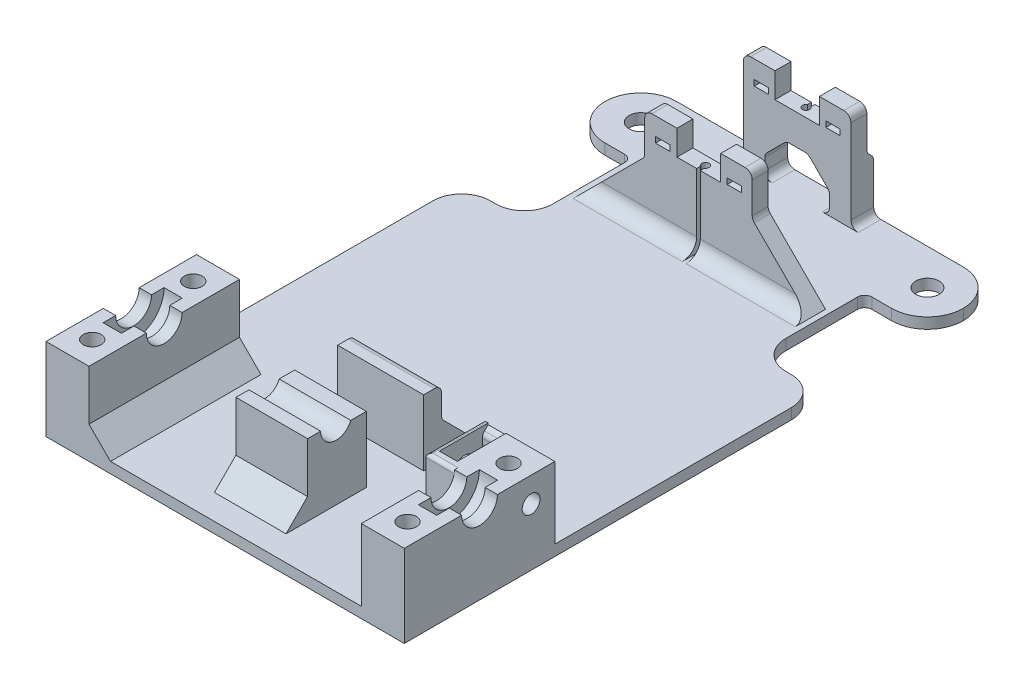
from build123d import *

# Parameters (mm, degrees)
BOSS_EXTRUDE1_DEPTH = 3
SKETCH2_W           = 12
SKETCH2_H           = 42
BOSS_EXTRUDE2_DEPTH = 20
SKETCH3_R           = 8.5
CUT_EXTRUDE1_DEPTH  = 2.55
CUT_EXTRUDE2_REACH  = 180.452
SKETCH4_R           = 5
BOSS_EXTRUDE3_DEPTH = 10
CHAMFER1_SIZE       = 6
CUT_EXTRUDE3_REACH  = 180.452
SKETCH7_R           = 2.5
CUT_EXTRUDE4_REACH  = 180.09
SKETCH8_W           = 8
SKETCH8_H           = 1.6
SKETCH9_W           = 8
SKETCH9_H           = 16
BOSS_EXTRUDE4_DEPTH = 20
CUT_EXTRUDE6_START  = -1.4
SKETCH11_R          = 5.55
CUT_EXTRUDE6_DEPTH  = 5
CUT_EXTRUDE7_START  = -1.4
CUT_EXTRUDE7_DEPTH  = 5
CHAMFER3_SIZE       = 2
CUT_EXTRUDE8_START  = -20
SKETCH13_R          = 2.5
CUT_EXTRUDE8_DEPTH  = 20
FILLET3_R           = 2
FILLET5_R           = 1
SKETCH14_W          = 24
SKETCH14_H          = 5
BOSS_EXTRUDE5_DEPTH = 18.4
CHAMFER4_SIZE       = 10
SKETCH15_W          = 100
SKETCH15_H          = 20
SKETCH15_R          = 3.25
BOSS_EXTRUDE6_DEPTH = 3
BOSS_EXTRUDE7_DEPTH = 20.5
SKETCH17_W          = 18
SKETCH17_H          = 12
CUT_EXTRUDE9_DEPTH  = 6.35
FILLET7_R           = 10
CHAMFER5_START      = -136.55
CHAMFER5_DEPTH      = 4.45
CHAMFER5_START_2    = 35
CHAMFER5_2_DEPTH    = 6
CHAMFER5_START_3    = 59
CHAMFER5_3_DEPTH    = 6
CHAMFER5_START_4    = 41
CHAMFER5_4_DEPTH    = 8.5
CHAMFER5_START_5    = 50.5
CHAMFER5_5_DEPTH    = 8.5
CHAMFER6_SIZE       = 6
FILLET6_R           = 2
SKETCH18_W          = 8.8
SKETCH18_H          = 4.45
SKETCH18_W_2        = 9
BOSS_EXTRUDE8_DEPTH = 7
FILLET9_R           = 4
FILLET8_R           = 2
CUT_EXTRUDE10_REACH = 196.574
SKETCH19_W          = 4
SKETCH19_H          = 1.6


with BuildPart() as part:
    # Sketch1 → Boss-Extrude1 (new body)
    with BuildSketch(Plane(origin=(0, 0, 0), x_dir=(1, 0, 0), z_dir=(0, 1, 0))):
        with BuildLine():
            Line((8, 116), (9.5, 116))
            ThreePointArc((9.5, 116), (15.156854249, 118.343145751), (17.5, 124))
            Line((17.5, 124), (17.5, 146))
            Line((17.5, 146), (82.5, 146))
            Line((82.5, 146), (82.5, 124))
            ThreePointArc((82.5, 124), (84.843145751, 118.343145751), (90.5, 116))
            Line((90.5, 116), (92, 116))
            ThreePointArc((92, 116), (97.656854249, 113.656854249), (100, 108))
            Line((100, 108), (100, 0))
            Line((100, 0), (0, 0))
            Line((0, 0), (0, 108))
            ThreePointArc((0, 108), (2.343145751, 113.656854249), (8, 116))
        make_face()
    extrude(amount=BOSS_EXTRUDE1_DEPTH)

    # Sketch2 → Boss-Extrude2 (add)
    with BuildSketch(Plane(origin=(0, 3, 0), x_dir=(1, 0, 0), z_dir=(0, 1, 0))):
        with Locations((6, 21)):
            Rectangle(SKETCH2_W, SKETCH2_H)
        with Locations((94, 21)):
            Rectangle(SKETCH2_W, SKETCH2_H)
    extrude(amount=BOSS_EXTRUDE2_DEPTH)

    # Sketch3 → Cut-Extrude1 (cut, symmetric)
    with BuildSketch(Plane(origin=(6, 0, 0), x_dir=(0, 0, -1), z_dir=(1, 0, 0))):
        with Locations((21, 23)):
            Circle(SKETCH3_R)
    cut_extrude1 = extrude(amount=CUT_EXTRUDE1_DEPTH, both=True, mode=Mode.SUBTRACT)

    # Cut-Extrude2: up to this face of the body (flat: up to its plane)
    cut_extrude2_end = Plane(part.part.faces().sort_by_distance((12, 13, -21))[0])
    # Sketch4 → Cut-Extrude2 (cut, up to the picked face)
    with BuildSketch(Plane.ZY, mode=Mode.PRIVATE) as cut_extrude2_sk1:
        with Locations((-21, 23)):
            Circle(SKETCH4_R)
    cut_extrude2_tool1 = split(extrude(cut_extrude2_sk1.sketch, amount=-CUT_EXTRUDE2_REACH, mode=Mode.PRIVATE), bisect_by=cut_extrude2_end, keep=Keep.BOTH, mode=Mode.PRIVATE)
    cut_extrude2 = cut_extrude2_tool1.solids().sort_by(Axis((0, 23, -21), (1, 0, 0)))[0]
    add(cut_extrude2, mode=Mode.SUBTRACT)

    # Mirror7: Cut-Extrude1, Cut-Extrude2 across plane
    add(cut_extrude1.mirror(Plane.ZY.offset(-50)), mode=Mode.SUBTRACT)
    add(cut_extrude2.mirror(Plane.ZY.offset(-50)), mode=Mode.SUBTRACT)

    # Sketch6 → Boss-Extrude3 (add, symmetric)
    with BuildSketch(Plane(origin=(50, 0, 0), x_dir=(0, 0, -1), z_dir=(1, 0, 0))):
        with BuildLine():
            ThreePointArc((25.06185692, 21.4), (20.185709658, 18.710989289), (16.634375, 23))
            Line((16.634375, 23), (13, 23))
            Line((13, 23), (13, 3))
            Line((13, 3), (29.4, 3))
            Line((29.4, 3), (29.4, 21.4))
            Line((29.4, 21.4), (25.06185692, 21.4))
        make_face()
    extrude(amount=BOSS_EXTRUDE3_DEPTH, both=True)

    # Chamfer1
    chamfer1_edges = [part.edges().sort_by_distance(p)[0] for p in [
        (50, 3, -13),
        (12, 3, -21),
    ]]
    chamfer(chamfer1_edges, length=CHAMFER1_SIZE)

    # Sketch7 → Cut-Extrude3 (cut, up to next)
    with BuildSketch(Plane(origin=(0, 23, 0), x_dir=(1, 0, 0), z_dir=(0, 1, 0)), mode=Mode.PRIVATE) as cut_extrude3_sk1:
        with Locations(Location((6, 35.1, 0), (0, 0, 270))):
            Circle(SKETCH7_R)
    cut_extrude3_tool1 = extrude(cut_extrude3_sk1.sketch, amount=-CUT_EXTRUDE3_REACH, mode=Mode.PRIVATE) & part.part
    # Sketch7 → Cut-Extrude3 (cut, up to next)
    with BuildSketch(Plane(origin=(0, 23, 0), x_dir=(1, 0, 0), z_dir=(0, 1, 0)), mode=Mode.PRIVATE) as cut_extrude3_sk2:
        with Locations(Location((6, 6.9, 0), (0, 0, 270))):
            Circle(SKETCH7_R)
    cut_extrude3_tool2 = extrude(cut_extrude3_sk2.sketch, amount=-CUT_EXTRUDE3_REACH, mode=Mode.PRIVATE) & part.part
    # Sketch7 → Cut-Extrude3 (cut, up to next)
    with BuildSketch(Plane(origin=(0, 23, 0), x_dir=(1, 0, 0), z_dir=(0, 1, 0)), mode=Mode.PRIVATE) as cut_extrude3_sk3:
        with Locations(Location((94, 6.9, 0), (0, 0, 90))):
            Circle(SKETCH7_R)
    cut_extrude3_tool3 = extrude(cut_extrude3_sk3.sketch, amount=-CUT_EXTRUDE3_REACH, mode=Mode.PRIVATE) & part.part
    # Sketch7 → Cut-Extrude3 (cut, up to next)
    with BuildSketch(Plane(origin=(0, 23, 0), x_dir=(1, 0, 0), z_dir=(0, 1, 0)), mode=Mode.PRIVATE) as cut_extrude3_sk4:
        with Locations(Location((94, 35.1, 0), (0, 0, 90))):
            Circle(SKETCH7_R)
    cut_extrude3_tool4 = extrude(cut_extrude3_sk4.sketch, amount=-CUT_EXTRUDE3_REACH, mode=Mode.PRIVATE) & part.part
    add(cut_extrude3_tool1.solids().sort_by_distance((6, 23, -35.1))[0], mode=Mode.SUBTRACT)
    add(cut_extrude3_tool2.solids().sort_by_distance((6, 23, -6.9))[0], mode=Mode.SUBTRACT)
    add(cut_extrude3_tool3.solids().sort_by_distance((94, 23, -6.9))[0], mode=Mode.SUBTRACT)
    add(cut_extrude3_tool4.solids().sort_by_distance((94, 23, -35.1))[0], mode=Mode.SUBTRACT)

    # Sketch8 → Cut-Extrude4 (cut, up to next)
    with BuildSketch(Plane(origin=(0, 3, 0), x_dir=(1, 0, 0), z_dir=(0, 1, 0)), mode=Mode.PRIVATE) as cut_extrude4_sk1:
        with Locations((33, 47)):
            Rectangle(SKETCH8_W, SKETCH8_H)
    cut_extrude4_tool1 = extrude(cut_extrude4_sk1.sketch, amount=-CUT_EXTRUDE4_REACH, mode=Mode.PRIVATE) & part.part
    # Sketch8 → Cut-Extrude4 (cut, up to next)
    with BuildSketch(Plane(origin=(0, 3, 0), x_dir=(1, 0, 0), z_dir=(0, 1, 0)), mode=Mode.PRIVATE) as cut_extrude4_sk2:
        with Locations((33, 27)):
            Rectangle(SKETCH8_W, SKETCH8_H)
    cut_extrude4_tool2 = extrude(cut_extrude4_sk2.sketch, amount=-CUT_EXTRUDE4_REACH, mode=Mode.PRIVATE) & part.part
    add(cut_extrude4_tool1.solids().sort_by_distance((33, 3, -47))[0], mode=Mode.SUBTRACT)
    add(cut_extrude4_tool2.solids().sort_by_distance((33, 3, -27))[0], mode=Mode.SUBTRACT)

    # Sketch9 → Boss-Extrude4 (add)
    with BuildSketch(Plane(origin=(0, 3, 0), x_dir=(1, 0, 0), z_dir=(0, 1, 0))):
        with Locations((84, 34)):
            Rectangle(SKETCH9_W, SKETCH9_H)
    extrude(amount=BOSS_EXTRUDE4_DEPTH)

    # Sketch11 → Cut-Extrude6 (cut)
    with BuildSketch(Plane.ZY.offset(-80).offset(CUT_EXTRUDE6_START)):
        with Locations((-35.4, 16)):
            Circle(SKETCH11_R)
    extrude(amount=-CUT_EXTRUDE6_DEPTH, mode=Mode.SUBTRACT)

    # Sketch12 → Cut-Extrude7 (cut)
    with BuildSketch(Plane.ZY.offset(-80).offset(CUT_EXTRUDE7_START)):
        with BuildLine():
            Line((-40.4, 18.408837894), (-40.4, 23))
            Line((-40.4, 23), (-30.4, 23))
            Line((-30.4, 23), (-30.4, 18.408837894))
            ThreePointArc((-30.4, 18.408837894), (-35.4, 21.55), (-40.4, 18.408837894))
        make_face()
    extrude(amount=-CUT_EXTRUDE7_DEPTH, mode=Mode.SUBTRACT)

    # Chamfer3
    # the kernel refuses this chamfer: 2 mm, written as the material it takes off along each edge
    with BuildSketch(Plane(origin=(81.4, 23, -40.4), x_dir=(0, 0, -1), z_dir=(1, 0, 0))) as chamfer3_piece_1:
        Polygon((CHAMFER3_SIZE, 0), (0, -CHAMFER3_SIZE), (0, 0), align=None)
    extrude(amount=5, mode=Mode.SUBTRACT)
    with BuildSketch(Plane(origin=(81.4, 23, -30.4), x_dir=(0, 0, 1), z_dir=(1, 0, 0))) as chamfer3_piece_2:
        Polygon((CHAMFER3_SIZE, 0), (0, CHAMFER3_SIZE), (0, 0), align=None)
    extrude(amount=5, mode=Mode.SUBTRACT)

    # Sketch13 → Cut-Extrude8 (cut)
    with BuildSketch(Plane.ZY.offset(-80).offset(CUT_EXTRUDE8_START)):
        with Locations((-35.4, 16)):
            Circle(SKETCH13_R)
    extrude(amount=CUT_EXTRUDE8_DEPTH, mode=Mode.SUBTRACT)

    # Fillet3
    fillet3_edges = [part.edges().sort_by_distance(p)[0] for p in [
        (83.9, 21, -40.4),
        (83.9, 21, -30.4),
    ]]
    fillet(fillet3_edges, radius=FILLET3_R)

    # Fillet5
    fillet5_edges = [part.edges().sort_by_distance(p)[0] for p in [
        (80, 23, -34),
        (84, 23, -26),
    ]]
    fillet(fillet5_edges, radius=FILLET5_R)

    # Sketch14 → Boss-Extrude5 (add)
    with BuildSketch(Plane(origin=(0, 3, 0), x_dir=(1, 0, 0), z_dir=(0, 1, 0))):
        with Locations((52, 43.9)):
            Rectangle(SKETCH14_W, SKETCH14_H)
    extrude(amount=BOSS_EXTRUDE5_DEPTH)

    # Chamfer4
    chamfer4_edges = [part.edges().sort_by_distance(p)[0] for p in [
        (52, 3, -46.4),
    ]]
    chamfer(chamfer4_edges, length=CHAMFER4_SIZE)

    # Sketch15 → Boss-Extrude6 (add)
    with BuildSketch(Plane(origin=(0, 3, 0), x_dir=(1, 0, 0), z_dir=(0, 1, 0))):
        with Locations((50, 156)):
            Rectangle(SKETCH15_W, SKETCH15_H)
        with Locations(Location((90, 156, 0), (0, 0, 270))):
            Circle(SKETCH15_R, mode=Mode.SUBTRACT)
        with Locations(Location((10, 156, 0), (0, 0, 270))):
            Circle(SKETCH15_R, mode=Mode.SUBTRACT)
    extrude(amount=-BOSS_EXTRUDE6_DEPTH)

    # Sketch16 → Boss-Extrude7 (add)
    with BuildSketch(Plane(origin=(0, 3, 0), x_dir=(1, 0, 0), z_dir=(0, 1, 0))):
        with BuildLine():
            Line((35, 164.1), (49.5, 164.1))
            Line((49.5, 164.1), (49.5, 162.966025404))
            ThreePointArc((49.5, 162.966025404), (50, 161.1), (50.5, 162.966025404))
            Line((50.5, 162.966025404), (50.5, 164.1))
            Line((50.5, 164.1), (65, 164.1))
            Line((65, 164.1), (65, 159.65))
            Line((65, 159.65), (35, 159.65))
            Line((35, 159.65), (35, 164.1))
        make_face()
        with BuildLine():
            Line((49.5, 132.1), (49.5, 133.233974596))
            ThreePointArc((49.5, 133.233974596), (50, 135.1), (50.5, 133.233974596))
            Line((50.5, 133.233974596), (50.5, 132.1))
            Line((50.5, 132.1), (65, 132.1))
            Line((65, 132.1), (65, 136.55))
            Line((65, 136.55), (35, 136.55))
            Line((35, 136.55), (35, 132.1))
            Line((35, 132.1), (49.5, 132.1))
        make_face()
    extrude(amount=BOSS_EXTRUDE7_DEPTH)

    # Sketch17 → Cut-Extrude9 (cut)
    with BuildSketch(Plane(origin=(0, 0, -166), x_dir=(-1, 0, 0), z_dir=(0, 0, -1))):
        with Locations((-50, 9)):
            Rectangle(SKETCH17_W, SKETCH17_H)
    extrude(amount=-CUT_EXTRUDE9_DEPTH, mode=Mode.SUBTRACT)

    # Fillet7
    fillet7_edges = [part.edges().sort_by_distance(p)[0] for p in [
        (0, 1.5, -146),
        (0, 1.5, -166),
        (100, 1.5, -166),
        (100, 1.5, -146),
    ]]
    fillet(fillet7_edges, radius=FILLET7_R - 0.0001)  # a hair under: the kernel refuses the full size

    # Chamfer5: read off the stored shape, not the designer's step
    # Chamfer5 outline → Chamfer5 (add)
    with BuildSketch(Plane.XY.offset(CHAMFER5_START)):
        Polygon((19, 3), (35, 3), (35, 19), align=None)
        Polygon((65, 19), (65, 3), (81, 3), align=None)
    extrude(amount=CHAMFER5_DEPTH)

    # Chamfer5 2 outline → Chamfer5 2 (add)
    with BuildSketch(Plane.YZ.offset(CHAMFER5_START_2)):
        Polygon((3, -164.1), (3, -166), (17.1, -166), (19, -164.1), align=None)
    extrude(amount=CHAMFER5_2_DEPTH)

    # Chamfer5 3 outline → Chamfer5 3 (add)
    with BuildSketch(Plane.YZ.offset(CHAMFER5_START_3)):
        Polygon((3, -164.1), (3, -166), (17.1, -166), (19, -164.1), align=None)
    extrude(amount=CHAMFER5_3_DEPTH)

    # Chamfer5 4 outline → Chamfer5 4 (add)
    with BuildSketch(Plane.YZ.offset(CHAMFER5_START_4)):
        Polygon((15, -164.1), (15, -166), (17.1, -166), (19, -164.1), align=None)
    extrude(amount=CHAMFER5_4_DEPTH)

    # Chamfer5 5 outline → Chamfer5 5 (add)
    with BuildSketch(Plane.YZ.offset(CHAMFER5_START_5)):
        Polygon((15, -164.1), (15, -166), (17.1, -166), (19, -164.1), align=None)
    extrude(amount=CHAMFER5_5_DEPTH)

    # Chamfer6
    chamfer6_edges = [part.edges().sort_by_distance(p)[0] for p in [
        (59, 15, -162.825),
        (41, 15, -162.825),
    ]]
    chamfer(chamfer6_edges, length=CHAMFER6_SIZE)

    # Fillet6
    fillet6_edges = [part.edges().sort_by_distance(p)[0] for p in [
        (17.5, 1.5, -146),
        (82.5, 1.5, -146),
        (52, 21.4, -46.4),
        (52, 13, -46.4),
        (35, 3, -162.825),
        (65, 3, -162.825),
        (59, 3, -162.825),
        (41, 3, -162.825),
        (35, 19, -134.325),
        (57.75, 19, -164.1),
        (42.25, 19, -164.1),
        (65, 19, -134.325),
        (57.75, 17.1, -166),
        (42.25, 17.1, -166),
        (53, 15, -162.825),
        (47, 15, -162.825),
        (41, 9, -162.825),
        (59, 9, -162.825),
    ]]
    fillet(fillet6_edges, radius=FILLET6_R)

    # Sketch18 → Boss-Extrude8 (add)
    with BuildSketch(Plane(origin=(0, 23.5, 0), x_dir=(1, 0, 0), z_dir=(0, 1, 0))):
        with Locations((60.6, 134.325)):
            Rectangle(SKETCH18_W, SKETCH18_H)
        with Locations((39.5, 134.325)):
            Rectangle(SKETCH18_W_2, SKETCH18_H)
        with Locations((60.6, 161.875)):
            Rectangle(SKETCH18_W, SKETCH18_H)
        with Locations((39.4, 161.875)):
            Rectangle(SKETCH18_W, SKETCH18_H)
    extrude(amount=BOSS_EXTRUDE8_DEPTH)

    # Fillet9
    fillet9_edges = [part.edges().sort_by_distance(p)[0] for p in [
        (34.25, 3, -132.1),
        (65.75, 3, -132.1),
    ]]
    fillet(fillet9_edges, radius=FILLET9_R)

    # Fillet8
    fillet8_edges = [part.edges().sort_by_distance(p)[0] for p in [
        (35, 30.5, -161.875),
        (65, 30.5, -161.875),
        (65, 30.5, -134.325),
        (35, 30.5, -134.325),
    ]]
    fillet(fillet8_edges, radius=FILLET8_R)

    # Cut-Extrude10: up to this face of the body (flat: up to its plane)
    cut_extrude10_end = Plane(part.part.faces().sort_by_distance((39.631250787, 16.379571676, -132.1))[0])
    # Sketch19 → Cut-Extrude10 (cut, up to the picked face)
    with BuildSketch(Plane(origin=(0, 0, -164.1), x_dir=(-1, 0, 0), z_dir=(0, 0, -1)), mode=Mode.PRIVATE) as cut_extrude10_sk1:
        with Locations((-60, 24.7)):
            Rectangle(SKETCH19_W, SKETCH19_H)
    cut_extrude10_tool1 = split(extrude(cut_extrude10_sk1.sketch, amount=-CUT_EXTRUDE10_REACH, mode=Mode.PRIVATE), bisect_by=cut_extrude10_end, keep=Keep.BOTH, mode=Mode.PRIVATE)
    # Sketch19 → Cut-Extrude10 (cut, up to the picked face)
    with BuildSketch(Plane(origin=(0, 0, -164.1), x_dir=(-1, 0, 0), z_dir=(0, 0, -1)), mode=Mode.PRIVATE) as cut_extrude10_sk2:
        with Locations((-40, 24.7)):
            Rectangle(SKETCH19_W, SKETCH19_H)
    cut_extrude10_tool2 = split(extrude(cut_extrude10_sk2.sketch, amount=-CUT_EXTRUDE10_REACH, mode=Mode.PRIVATE), bisect_by=cut_extrude10_end, keep=Keep.BOTH, mode=Mode.PRIVATE)
    add(cut_extrude10_tool1.solids().sort_by(Axis((60, 24.7, -164.1), (0, 0, 1)))[0], mode=Mode.SUBTRACT)
    add(cut_extrude10_tool2.solids().sort_by(Axis((40, 24.7, -164.1), (0, 0, 1)))[0], mode=Mode.SUBTRACT)


solid = part.part
